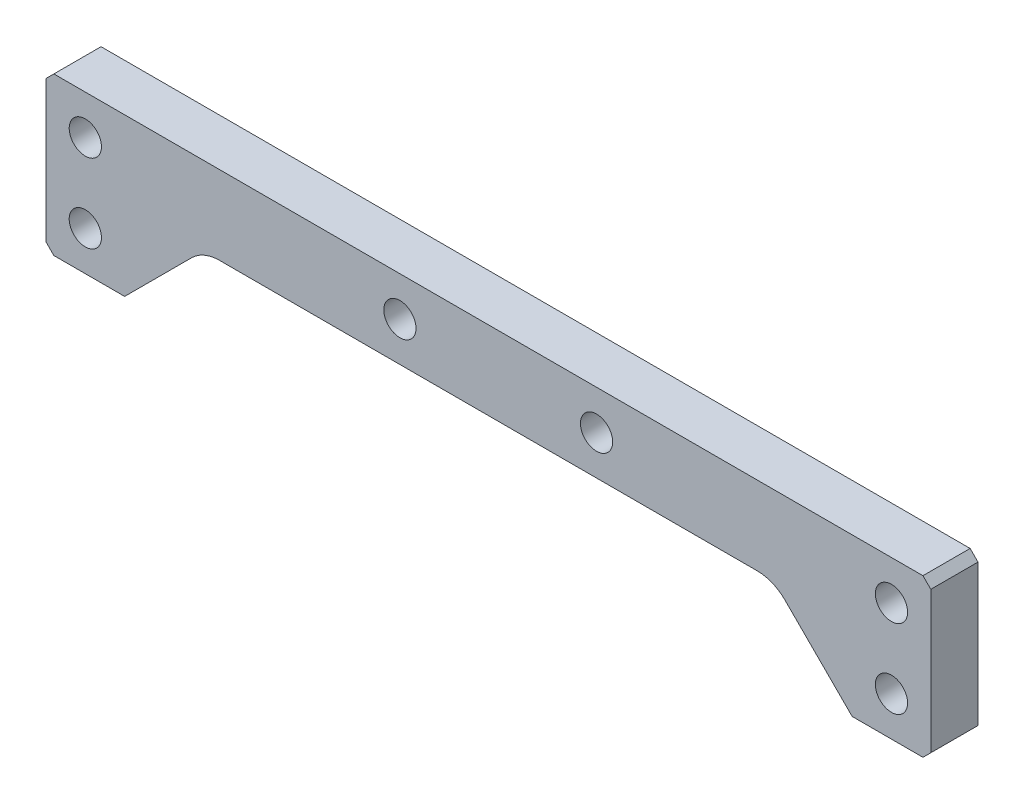
from build123d import *

# Parameters (mm, degrees)
SKETCH_1_R      = 4.1
EXTRUDE_1_DEPTH = 12
CHAMFER_1_SIZE  = 20
FILLET_1_R      = 10
CHAMFER_2_SIZE  = 2


with BuildPart() as part:
    # 草图1 → 凸台-拉伸1 (new body)
    with BuildSketch(Plane.XY):
        Polygon((-140, -10), (-140, -30), (-120, -30), (-120, -10), (10, -10), (65, -10), (65, -30), (85, -30), (85, 10), (10, 10), (-120, 10), (-140, 10), align=None)
        Circle(SKETCH_1_R, mode=Mode.SUBTRACT)
        with Locations((-50, 0)):
            Circle(SKETCH_1_R, mode=Mode.SUBTRACT)
        with Locations((-130, 0)):
            Circle(SKETCH_1_R, mode=Mode.SUBTRACT)
        with Locations((-130, -20)):
            Circle(SKETCH_1_R, mode=Mode.SUBTRACT)
        with Locations((75, 0)):
            Circle(SKETCH_1_R, mode=Mode.SUBTRACT)
        with Locations((75, -20)):
            Circle(SKETCH_1_R, mode=Mode.SUBTRACT)
    extrude(amount=EXTRUDE_1_DEPTH)

    # 倒角1
    chamfer_1_edges = [part.edges().sort_by_distance(p)[0] for p in [
        (65, -10, 6),
        (-120, -10, 6),
    ]]
    chamfer(chamfer_1_edges, length=CHAMFER_1_SIZE - 0.0001)  # a hair under: the kernel refuses the full size

    # 圆角1
    fillet_1_edges = [part.edges().sort_by_distance(p)[0] for p in [
        (-100.0001, -10, 6),
        (45.0001, -10, 6),
    ]]
    fillet(fillet_1_edges, radius=FILLET_1_R)

    # 倒角2
    chamfer_2_edges = [part.edges().sort_by_distance(p)[0] for p in [
        (-140, -30, 6),
        (-140, 10, 6),
        (85, 10, 6),
        (85, -30, 6),
    ]]
    chamfer(chamfer_2_edges, length=CHAMFER_2_SIZE)


solid = part.part
